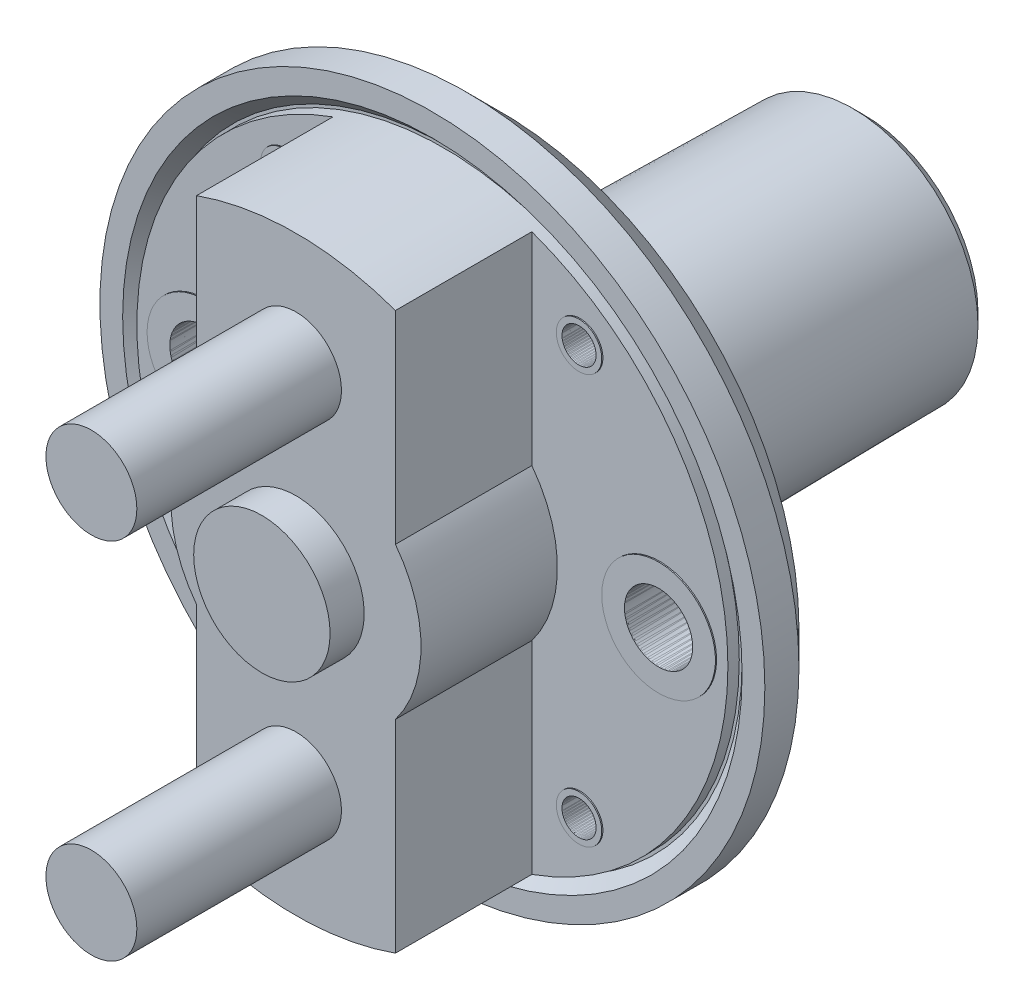
from build123d import *

# Parameters (mm, degrees)
SKETCH_1_R             = 11
SKETCH_2_R             = 11.5
SKETCH_3_R             = 5.5
CUT_EXTRUDE_1_DEPTH    = 14.5
CHAMFER_1_SIZE         = 1
CHAMFER_1_SIZE2        = 1.015997016
CHAMFER_2_SIZE         = 0.5
SKETCH_4_R             = 29.25
EXTRUDE_1_DEPTH        = 6
CHAMFER_3_SIZE         = 3
SKETCH_5_R             = 26.25
SKETCH_5_R_2           = 26
CUT_EXTRUDE_2_DEPTH    = 1
CHAMFER_4_SIZE         = 1
EXTRUDE_START          = 12
EXTRUDE_2_DEPTH        = 12
SKETCH_7_R             = 6
EXTRUDE_3_DEPTH        = 3
SKETCH_8_R             = 4
EXTRUDE_4_DEPTH        = 18
EXTRUDE_4_2_DEPTH      = 18
SKETCH_10_R            = 1.5
SKETCH_10_R_2          = 3
CUT_EXTRUDE_4_DEPTH    = 55.837259231
EXTRUDE_5_DEPTH        = 0.1
EXTRUDE_5_DEPTH_BACK   = 6.1
SKETCH_11_R            = 5
SKETCH_11_R_2          = 3
EXTRUDE_5_2_DEPTH      = 0.1
EXTRUDE_5_2_DEPTH_BACK = 6.1
EXTRUDE_5_3_DEPTH      = 0.1
EXTRUDE_5_3_DEPTH_BACK = 6.1
SKETCH_11_R_3          = 2
SKETCH_11_R_4          = 1.5
EXTRUDE_5_4_DEPTH      = 0.1
EXTRUDE_5_4_DEPTH_BACK = 6.1
EXTRUDE_5_5_DEPTH      = 0.1
EXTRUDE_5_5_DEPTH_BACK = 6.1
EXTRUDE_5_6_DEPTH      = 0.1
EXTRUDE_5_6_DEPTH_BACK = 6.1


with BuildPart() as part:
    # ｽｹｯﾁ1 → ﾛﾌﾄ1 section 0
    with BuildSketch(Plane.XY):
        Circle(SKETCH_1_R)
    # ｽｹｯﾁ2 → ﾛﾌﾄ1 section 1
    with BuildSketch(Plane.XY.offset(32)):
        Circle(SKETCH_2_R)
    loft()

    # ｽｹｯﾁ3 → ｶｯﾄ - 押し出し1 (cut)
    with BuildSketch(Plane(origin=(0, 0, 0), x_dir=(-1, 0, 0), z_dir=(0, 0, -1))):
        Circle(SKETCH_3_R)
        with BuildLine():
            ThreePointArc((2.5, -4.898979486), (0, -5.5), (-2.5, -4.898979486))
            Line((-2.5, -4.898979486), (-2.5, -7.898979486))
            Line((-2.5, -7.898979486), (2.5, -7.898979486))
            Line((2.5, -7.898979486), (2.5, -4.898979486))
        make_face()
    extrude(amount=-CUT_EXTRUDE_1_DEPTH, mode=Mode.SUBTRACT)

    # 面取り1
    chamfer_1_edges = [part.edges().sort_by_distance(p)[0] for p in [
        (-11, 0, 0),
    ]]
    chamfer_1_side = [part.faces().sort_by_distance(p)[0] for p in [
        (-10.688873016, 0, 0),
    ]]
    chamfer(chamfer_1_edges, length=CHAMFER_1_SIZE, length2=CHAMFER_1_SIZE2, reference=chamfer_1_side[0])

    # 面取り2
    chamfer_2_edges = [part.edges().sort_by_distance(p)[0] for p in [
        (0, 5.5, 0),
        (2.5, -6.398979486, 0),
        (0, -7.898979486, 0),
        (-2.5, -6.398979486, 0),
    ]]
    chamfer(chamfer_2_edges, length=CHAMFER_2_SIZE)

    # ｽｹｯﾁ4 → ﾎﾞｽ - 押し出し1 (add)
    with BuildSketch(Plane.XY.offset(32)):
        Circle(SKETCH_4_R)
    extrude(amount=EXTRUDE_1_DEPTH)

    # 面取り3
    chamfer_3_edges = [part.edges().sort_by_distance(p)[0] for p in [
        (-29.25, 0, 32),
    ]]
    chamfer(chamfer_3_edges, length=CHAMFER_3_SIZE)

    # ｽｹｯﾁ5 → ｶｯﾄ - 押し出し2 (cut)
    with BuildSketch(Plane.XY.offset(38)):
        Circle(SKETCH_5_R)
        Circle(SKETCH_5_R_2, mode=Mode.SUBTRACT)
    extrude(amount=-CUT_EXTRUDE_2_DEPTH, mode=Mode.SUBTRACT)

    # 面取り4
    chamfer_4_edges = [part.edges().sort_by_distance(p)[0] for p in [
        (-26.25, 0, 38),
    ]]
    chamfer(chamfer_4_edges, length=CHAMFER_4_SIZE - 0.0001)  # a hair under: the kernel refuses the full size

    # ｽｹｯﾁ6 → ﾎﾞｽ - 押し出し2 (add)
    with BuildSketch(Plane.XY.offset(38).offset(EXTRUDE_START)):
        with BuildLine():
            Line((8.75, 6.666145813), (8.75, 24.483412752))
            ThreePointArc((8.75, 24.483412752), (0, 26), (-8.75, 24.483412752))
            Line((-8.75, 24.483412752), (-8.75, 6.666145813))
            ThreePointArc((-8.75, 6.666145813), (-11, 0), (-8.75, -6.666145813))
            Line((-8.75, -6.666145813), (-8.75, -24.483412752))
            ThreePointArc((-8.75, -24.483412752), (0, -26), (8.75, -24.483412752))
            Line((8.75, -24.483412752), (8.75, -6.666145813))
            ThreePointArc((8.75, -6.666145813), (11, 0), (8.75, 6.666145813))
        make_face()
    extrude(amount=-EXTRUDE_2_DEPTH)

    # ｽｹｯﾁ7 → ﾎﾞｽ - 押し出し3 (add)
    with BuildSketch(Plane.XY.offset(50)):
        with Locations(Location((0, 0, 0), (0, 0, 180))):
            Circle(SKETCH_7_R)
    extrude(amount=EXTRUDE_3_DEPTH)

    # ｽｹｯﾁ10 → ｶｯﾄ - 押し出し4 (cut, through all)
    with BuildSketch(Plane(origin=(0, 0, 32), x_dir=(-1, 0, 0), z_dir=(0, 0, -1))):
        with Locations((13, 18)):
            Circle(SKETCH_10_R)
        with Locations((-13, 18)):
            Circle(SKETCH_10_R)
        with Locations((-13, -18)):
            Circle(SKETCH_10_R)
        with Locations((13, -18)):
            Circle(SKETCH_10_R)
        with Locations((-20, 0)):
            Circle(SKETCH_10_R_2)
        with Locations((20, 0)):
            Circle(SKETCH_10_R_2)
    extrude(amount=-CUT_EXTRUDE_4_DEPTH, mode=Mode.SUBTRACT)


with BuildPart() as body_2:
    # ｽｹｯﾁ8 → ﾎﾞｽ - 押し出し4 (new body)
    with BuildSketch(Plane.XY.offset(50)):
        with Locations((0, 16)):
            Circle(SKETCH_8_R)
    extrude(amount=EXTRUDE_4_DEPTH)


with BuildPart() as body_3:
    # ｽｹｯﾁ8 → Extrude 4 2 (new body)
    with BuildSketch(Plane.XY.offset(50)):
        with Locations((0, -16)):
            Circle(SKETCH_8_R)
    extrude(amount=EXTRUDE_4_2_DEPTH)


with BuildPart() as body_4:
    # ｽｹｯﾁ11 → ﾎﾞｽ - 押し出し5 (new, two sides: drawn at the far end of the back side and taken through both)
    with BuildSketch(Plane(origin=(0, 0, 32), x_dir=(-1, 0, 0), z_dir=(0, 0, -1)).offset(-EXTRUDE_5_DEPTH_BACK)):
        with Locations((-20, 0)):
            Circle(SKETCH_11_R)
        with Locations((-20, 0)):
            Circle(SKETCH_11_R_2, mode=Mode.SUBTRACT)
    extrude(amount=EXTRUDE_5_DEPTH + EXTRUDE_5_DEPTH_BACK)


with BuildPart() as body_5:
    # ｽｹｯﾁ11 → Extrude 5 2 (new, two sides: drawn at the far end of the back side and taken through both)
    with BuildSketch(Plane(origin=(0, 0, 32), x_dir=(-1, 0, 0), z_dir=(0, 0, -1)).offset(-EXTRUDE_5_2_DEPTH_BACK)):
        with Locations((20, 0)):
            Circle(SKETCH_11_R)
        with Locations((20, 0)):
            Circle(SKETCH_11_R_2, mode=Mode.SUBTRACT)
    extrude(amount=EXTRUDE_5_2_DEPTH + EXTRUDE_5_2_DEPTH_BACK)


with BuildPart() as body_6:
    # ｽｹｯﾁ11 → Extrude 5 3 (new, two sides: drawn at the far end of the back side and taken through both)
    with BuildSketch(Plane(origin=(0, 0, 32), x_dir=(-1, 0, 0), z_dir=(0, 0, -1)).offset(-EXTRUDE_5_3_DEPTH_BACK)):
        with Locations((13, 18)):
            Circle(SKETCH_11_R_3)
        with Locations((13, 18)):
            Circle(SKETCH_11_R_4, mode=Mode.SUBTRACT)
    extrude(amount=EXTRUDE_5_3_DEPTH + EXTRUDE_5_3_DEPTH_BACK)


with BuildPart() as body_7:
    # ｽｹｯﾁ11 → Extrude 5 4 (new, two sides: drawn at the far end of the back side and taken through both)
    with BuildSketch(Plane(origin=(0, 0, 32), x_dir=(-1, 0, 0), z_dir=(0, 0, -1)).offset(-EXTRUDE_5_4_DEPTH_BACK)):
        with Locations((-13, 18)):
            Circle(SKETCH_11_R_3)
        with Locations((-13, 18)):
            Circle(SKETCH_11_R_4, mode=Mode.SUBTRACT)
    extrude(amount=EXTRUDE_5_4_DEPTH + EXTRUDE_5_4_DEPTH_BACK)


with BuildPart() as body_8:
    # ｽｹｯﾁ11 → Extrude 5 5 (new, two sides: drawn at the far end of the back side and taken through both)
    with BuildSketch(Plane(origin=(0, 0, 32), x_dir=(-1, 0, 0), z_dir=(0, 0, -1)).offset(-EXTRUDE_5_5_DEPTH_BACK)):
        with Locations((-13, -18)):
            Circle(SKETCH_11_R_3)
        with Locations((-13, -18)):
            Circle(SKETCH_11_R_4, mode=Mode.SUBTRACT)
    extrude(amount=EXTRUDE_5_5_DEPTH + EXTRUDE_5_5_DEPTH_BACK)


with BuildPart() as body_9:
    # ｽｹｯﾁ11 → Extrude 5 6 (new, two sides: drawn at the far end of the back side and taken through both)
    with BuildSketch(Plane(origin=(0, 0, 32), x_dir=(-1, 0, 0), z_dir=(0, 0, -1)).offset(-EXTRUDE_5_6_DEPTH_BACK)):
        with Locations((13, -18)):
            Circle(SKETCH_11_R_3)
        with Locations((13, -18)):
            Circle(SKETCH_11_R_4, mode=Mode.SUBTRACT)
    extrude(amount=EXTRUDE_5_6_DEPTH + EXTRUDE_5_6_DEPTH_BACK)


solid = Compound([part.part, body_2.part, body_3.part, body_4.part, body_5.part, body_6.part, body_7.part, body_8.part, body_9.part])
